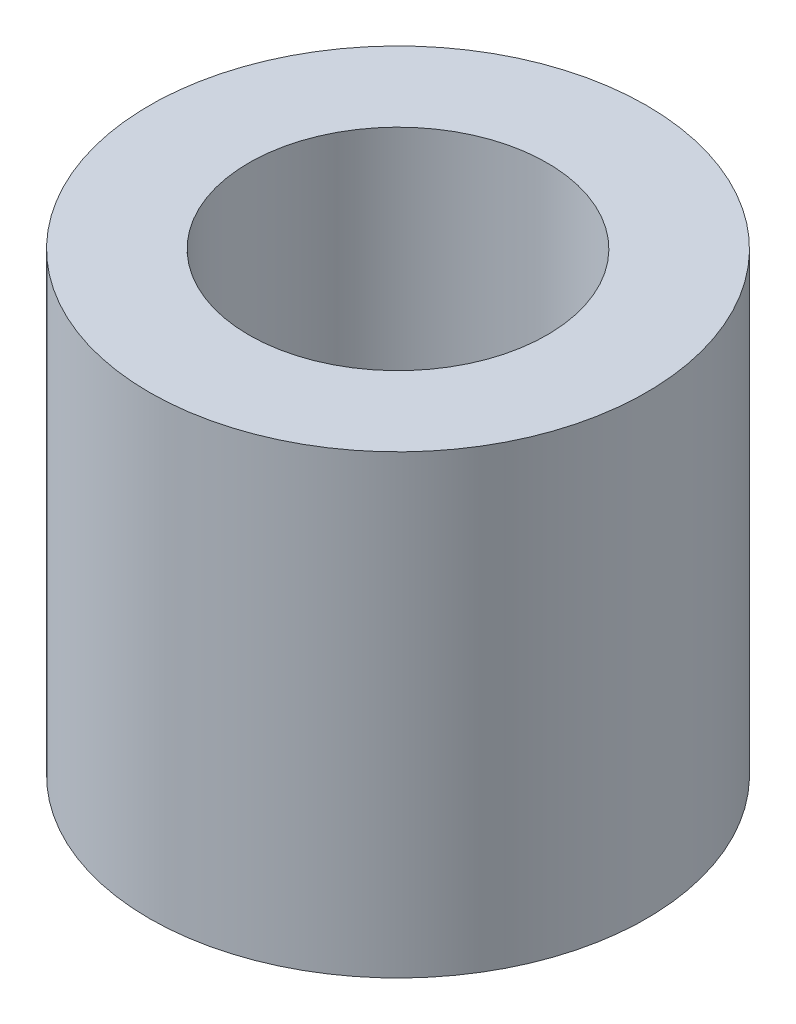
from build123d import *

# Parameters (mm, degrees)
SKETCH1_R           = 3
SKETCH1_R_2         = 1.8
BOSS_EXTRUDE1_DEPTH = 5.5


with BuildPart() as part:
    # Sketch1 → Boss-Extrude1 (new body)
    with BuildSketch(Plane(origin=(0, 0, 0), x_dir=(1, 0, 0), z_dir=(0, 1, 0))):
        Circle(SKETCH1_R)
        Circle(SKETCH1_R_2, mode=Mode.SUBTRACT)
    extrude(amount=BOSS_EXTRUDE1_DEPTH)


solid = part.part
